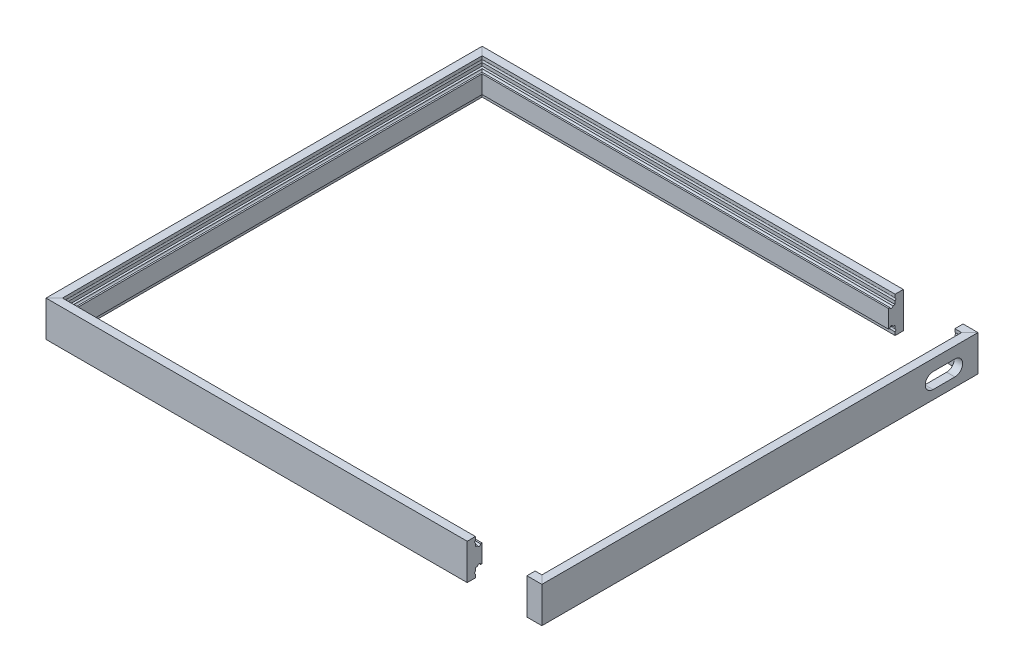
from build123d import *

# Parameters (mm, degrees)
CUT_EXTRUDE_2_REACH = 204.588
SKETCH_7_W          = 140.5
SKETCH_7_H          = 140.5
SKETCH_7_W_2        = 140
SKETCH_7_H_2        = 140
SKETCH_8_W          = 140.5
SKETCH_8_H          = 140.5
CUT_EXTRUDE_3_DEPTH = 3
CUT_EXTRUDE_4_REACH = 206.453
CUT_EXTRUDE_6_REACH = 217.421
EXTRUDE_1_DEPTH     = 2
FILLET_START        = 157
FILLET_1_DEPTH      = 3.25
FILLET_2_R          = 1
SKETCH_13_W         = 2.25
SKETCH_13_H         = 6
EXTRUDE_2_DEPTH     = 2.25
CUT_EXTRUDE_7_DEPTH = 2.25


with BuildPart() as part:
    # 掃出3: sweep along a path in 草圖1
    with BuildLine(Plane(origin=(0, 0, 0), x_dir=(1, 0, 0), z_dir=(0, 1, 0))) as sweep_3_path:
        Line((0, 0), (140, 0))
        Line((140, 0), (140, -140))
        Line((140, -140), (0, -140))
        Line((0, -140), (0, 0))
    # 草圖4 → 掃出3 (sweep)
    with BuildSketch(Plane(origin=(140, 0, 0), x_dir=(0, 0, -1), z_dir=(1, 0, 0))):
        with BuildLine():
            Line((-143, 6), (-140, 6))
            Line((-140, 6), (-140, 5))
            ThreePointArc((-140, 5), (-140.5, 4.5), (-140, 4))
            Line((-140, 4), (-140, 3))
            Line((-140, 3), (-139.5, 3))
            ThreePointArc((-139.5, 3), (-139, 2.5), (-138.5, 3))
            Line((-138.5, 3), (-138, 3))
            Line((-138, 3), (-138, -3))
            Line((-138, -3), (-138.5, -3))
            ThreePointArc((-138.5, -3), (-139, -2.5), (-139.5, -3))
            Line((-139.5, -3), (-140, -3))
            Line((-140, -3), (-140, -4))
            ThreePointArc((-140, -4), (-140.5, -4.5), (-140, -5))
            Line((-140, -5), (-140, -6))
            Line((-140, -6), (-143, -6))
            Line((-143, -6), (-143, 6))
        make_face()
    sweep(path=sweep_3_path.line, transition=Transition.RIGHT)

    # 除料-伸長2: up to this face of the body (flat: up to its plane)
    cut_extrude_2_end = Plane(part.part.faces().sort_by_distance((70, 3, 0.302010101))[0])
    # 草圖7 → 除料-伸長2 (cut, up to the picked face)
    with BuildSketch(Plane(origin=(0, 6, 0), x_dir=(-1, 0, 0), z_dir=(0, -1, 0)), mode=Mode.PRIVATE) as cut_extrude_2_sk1:
        with Locations((-70, -70)):
            Rectangle(SKETCH_7_W, SKETCH_7_H)
        with Locations((-70, -70)):
            Rectangle(SKETCH_7_W_2, SKETCH_7_H_2, mode=Mode.SUBTRACT)
    cut_extrude_2_tool1 = split(extrude(cut_extrude_2_sk1.sketch, amount=CUT_EXTRUDE_2_REACH, mode=Mode.PRIVATE), bisect_by=cut_extrude_2_end, keep=Keep.BOTH, mode=Mode.PRIVATE)
    add(cut_extrude_2_tool1.solids().sort_by(Axis((70, 6, 140.051303), (0, -1, 0)))[0], mode=Mode.SUBTRACT)

    # 草圖8 → 除料-伸長3 (cut)
    with BuildSketch(Plane(origin=(0, -6, 0), x_dir=(1, 0, 0), z_dir=(0, 1, 0))):
        with Locations((70, -70)):
            Rectangle(SKETCH_8_W, SKETCH_8_H)
    extrude(amount=CUT_EXTRUDE_3_DEPTH, mode=Mode.SUBTRACT)

    # 除料-伸長4: up to this face of the body (flat: up to its plane)
    cut_extrude_4_end = Plane(part.part.faces().sort_by_distance((138, 0, 70))[0])
    # 草圖9 → 除料-伸長4 (cut, up to the picked face)
    with BuildSketch(Plane(origin=(143, 0, 0), x_dir=(0, 0, -1), z_dir=(1, 0, 0)), mode=Mode.PRIVATE) as cut_extrude_4_sk1:
        with BuildLine():
            Line((-12.05, 2.2), (-4.75, 2.2))
            ThreePointArc((-4.75, 2.2), (-2.15, -0.4), (-4.75, -3))
            Line((-4.75, -3), (-12.05, -3))
            ThreePointArc((-12.05, -3), (-14.65, -0.4), (-12.05, 2.2))
        make_face()
    cut_extrude_4_tool1 = split(extrude(cut_extrude_4_sk1.sketch, amount=-CUT_EXTRUDE_4_REACH, mode=Mode.PRIVATE), bisect_by=cut_extrude_4_end, keep=Keep.BOTH, mode=Mode.PRIVATE)
    add(cut_extrude_4_tool1.solids().sort_by(Axis((143, -0.4, 8.4), (-1, 0, 0)))[0], mode=Mode.SUBTRACT)


with BuildPart() as body_2:
    # Split Bodies 2: read off the stored shape, not the designer's step
    # Split Bodies 2: the piece on the far side of the plane
    add(part.part)
    split(bisect_by=Plane.YZ.offset(138), keep=Keep.BOTTOM)


with BuildPart() as part_1:
    add(part.part)

    # Split Bodies 2
    split(bisect_by=Plane.YZ.offset(138), keep=Keep.TOP)


with BuildPart() as part_2:
    # Move Body 1: moved
    add(part_1.part.moved(Location((20, 0, 0))))

    # 除料-伸長6: up to this face of the body (flat: up to its plane)
    cut_extrude_6_end = Plane(part_2.part.faces().sort_by_distance((160.25, -3.533493649, 70))[0])
    # 草圖11 → 除料-伸長6 (cut, up to the picked face)
    with BuildSketch(Plane.ZY.offset(-158), mode=Mode.PRIVATE) as cut_extrude_6_sk1:
        with BuildLine():
            Line((12.050000019, 3), (2, 3))
            Line((2, 3), (2, -3))
            Line((2, -3), (4.75, -3))
            ThreePointArc((4.75, -3), (2.15, -0.4), (4.75, 2.2))
            Line((4.75, 2.2), (9.85910977, 2.2))
            ThreePointArc((9.85910977, 2.2), (10.88380963, 2.793743888), (12.050000019, 3))
        make_face()
    cut_extrude_6_tool1 = split(extrude(cut_extrude_6_sk1.sketch, amount=-CUT_EXTRUDE_6_REACH, mode=Mode.PRIVATE), bisect_by=cut_extrude_6_end, keep=Keep.BOTH, mode=Mode.PRIVATE)
    # 草圖11 → 除料-伸長6 (cut, up to the picked face)
    with BuildSketch(Plane.ZY.offset(-158), mode=Mode.PRIVATE) as cut_extrude_6_sk2:
        with BuildLine():
            ThreePointArc((15.45, -0.4), (14.454163063, 2.004163049), (12.050000019, 3))
            ThreePointArc((12.050000019, 3), (10.88380963, 2.793743888), (9.85910977, 2.2))
            Line((9.85910977, 2.2), (12.05, 2.2))
            ThreePointArc((12.05, 2.2), (14.65, -0.4), (12.05, -3))
            Line((12.05, -3), (14.24089023, -3))
            ThreePointArc((14.24089023, -3), (15.132939083, -1.833696833), (15.45, -0.4))
        make_face()
    cut_extrude_6_tool2 = split(extrude(cut_extrude_6_sk2.sketch, amount=-CUT_EXTRUDE_6_REACH, mode=Mode.PRIVATE), bisect_by=cut_extrude_6_end, keep=Keep.BOTH, mode=Mode.PRIVATE)
    # 草圖11 → 除料-伸長6 (cut, up to the picked face)
    with BuildSketch(Plane.ZY.offset(-158), mode=Mode.PRIVATE) as cut_extrude_6_sk3:
        with BuildLine():
            Line((12.05, 2.2), (9.85910977, 2.2))
            ThreePointArc((9.85910977, 2.2), (9.45, -2.59089023), (14.24089023, -3))
            Line((14.24089023, -3), (12.05, -3))
            ThreePointArc((12.05, -3), (14.65, -0.4), (12.05, 2.2))
        make_face()
    cut_extrude_6_tool3 = split(extrude(cut_extrude_6_sk3.sketch, amount=-CUT_EXTRUDE_6_REACH, mode=Mode.PRIVATE), bisect_by=cut_extrude_6_end, keep=Keep.BOTH, mode=Mode.PRIVATE)
    add(cut_extrude_6_tool1.solids().sort_by(Axis((158, 2.903691, 10.843662), (1, 0, 0)))[0], mode=Mode.SUBTRACT)
    add(cut_extrude_6_tool2.solids().sort_by(Axis((158, -1.799115, 15.058576), (1, 0, 0)))[0], mode=Mode.SUBTRACT)
    add(cut_extrude_6_tool3.solids().sort_by(Axis((158, -0.643627, 11.61632), (1, 0, 0)))[0], mode=Mode.SUBTRACT)

    # 草圖12 → 填料-伸長1 (add)
    with BuildSketch(Plane.ZY.offset(-158)):
        with BuildLine():
            ThreePointArc((17.45, -0.4), (17.13990526, 1.403569915), (16.245235393, 3))
            Line((16.245235393, 3), (12.05, 3))
            ThreePointArc((12.05, 3), (15.243743885, 0.766190379), (14.24089023, -3))
            Line((14.24089023, -3), (16.782863826, -3))
            ThreePointArc((16.782863826, -3), (17.280557555, -1.742113136), (17.45, -0.4))
        make_face()
    extrude(amount=-EXTRUDE_1_DEPTH)

    # 圓角1: read off the stored shape, not the designer's step
    # 圓角1 outline → 圓角1 (cut)
    with BuildSketch(Plane.YZ.offset(FILLET_START)):
        with BuildLine():
            Line((3, 12.05), (3, 15.737817783))
            ThreePointArc((3, 15.737817783), (2.476731295, 14.85876871), (1.454545455, 14.899677378))
            ThreePointArc((1.454545455, 14.899677378), (2.588766848, 13.670886402), (3, 12.05))
        make_face()
    extrude(amount=FILLET_1_DEPTH, mode=Mode.SUBTRACT)

    # 圓角2
    fillet_2_edges = [part_2.edges().sort_by_distance(p)[0] for p in [
        (159.125, -3, 14.24089023),
    ]]
    fillet(fillet_2_edges, radius=FILLET_2_R)

    # 草圖13 → 填料-伸長2 (add)
    with BuildSketch(Plane.XY.offset(2)):
        with Locations((159.125, 0)):
            Rectangle(SKETCH_13_W, SKETCH_13_H)
    extrude(amount=-EXTRUDE_2_DEPTH)

    # 草圖14 → 除料-伸長7 (cut)
    with BuildSketch(Plane.ZY.offset(-158)):
        with BuildLine():
            Line((0.5, 3), (1.5, 3))
            ThreePointArc((1.5, 3), (1, 3.5), (0.5, 3))
        make_face()
        with BuildLine():
            ThreePointArc((0.5, 3), (1, 2.5), (1.5, 3))
            Line((1.5, 3), (0.5, 3))
        make_face()
        with BuildLine():
            Line((0.5, -3), (1.5, -3))
            ThreePointArc((1.5, -3), (1, -2.5), (0.5, -3))
        make_face()
        with BuildLine():
            ThreePointArc((0.5, -3), (1, -3.5), (1.5, -3))
            Line((1.5, -3), (0.5, -3))
        make_face()
    extrude(amount=-CUT_EXTRUDE_7_DEPTH, mode=Mode.SUBTRACT)


solid = Compound([body_2.part, part_2.part])
